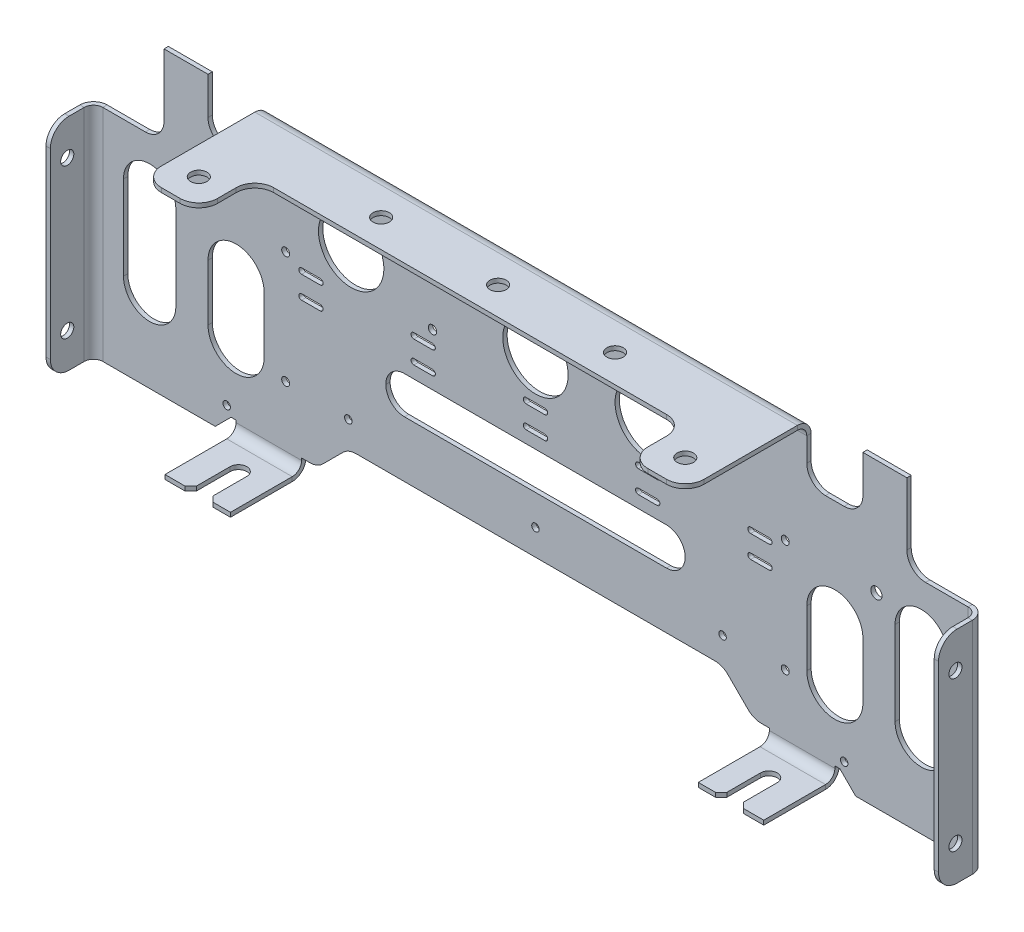
from build123d import *

# Parameters (mm, degrees)
SKETCH1_W                       = 477
SKETCH1_H                       = 127.62
BASE_FLANGE1_DEPTH              = 2.31
EDGE_FLANGE1_STRIP_W            = 19.24
EDGE_FLANGE1_STRIP_H            = 2.31
EDGE_FLANGE1_STRIP_CUT_DEPTH    = 127.62
EDGE_FLANGE1_STRIP_2_W          = 19.24
EDGE_FLANGE1_STRIP_2_H          = 2.31
EDGE_FLANGE1_STRIP_CUT_2_DEPTH  = 127.62
EDGE_FLANGE1_DEPTH              = 127.62
EDGE_FLANGE1_BEND_DEPTH         = 127.62
SKETCH12_W                      = 40
SKETCH12_H                      = 10
CUT_EXTRUDE1_DEPTH              = 249.191712392
SKETCH14_W                      = 397
SKETCH14_H                      = 33.43
BOSS_EXTRUDE1_DEPTH             = 2.31
FILLET1_R                       = 10
SKETCH15_R                      = 3.5
CUT_EXTRUDE3_DEPTH              = 488.357944123
CUT_EXTRUDE4_DEPTH              = 10
SKETCH17_W                      = 30
SKETCH17_H                      = 30
CUT_EXTRUDE5_DEPTH              = 10
SKETCH18_W                      = 160
SKETCH18_H                      = 20
CUT_EXTRUDE6_DEPTH              = 10
CUT_EXTRUDE8_REACH              = 260.811
SKETCH19_R                      = 2
SKETCH20_R                      = 17.4625
CUT_EXTRUDE9_DEPTH              = 10
FILLET2_R                       = 10
EDGE_FLANGE2_STRIP_W            = 19.24
EDGE_FLANGE2_STRIP_H            = 2.31
EDGE_FLANGE2_STRIP_CUT_DEPTH    = 290
EDGE_FLANGE2_DEPTH              = 290
SKETCH30_R                      = 2.25
CUT_EXTRUDE11_DEPTH             = 10
SKETCH32_W                      = 30
SKETCH32_H                      = 30
BOSS_EXTRUDE2_DEPTH             = 2.31
FILLET3_R                       = 10
SKETCH29_R                      = 4.375
CUT_EXTRUDE10_DEPTH             = 10
CUT_EXTRUDE12_DEPTH             = 10
EDGE_FLANGE3_STRIP_W            = 19.24
EDGE_FLANGE3_STRIP_H            = 2.31
EDGE_FLANGE3_STRIP_CUT_DEPTH    = 35
EDGE_FLANGE3_RELIEF_W           = 20.395
EDGE_FLANGE3_RELIEF_H           = 1.155
EDGE_FLANGE3_RELIEF_CUT_DEPTH   = 2.31
EDGE_FLANGE3_STRIP_2_W          = 19.24
EDGE_FLANGE3_STRIP_2_H          = 2.31
EDGE_FLANGE3_STRIP_CUT_2_DEPTH  = 35
EDGE_FLANGE3_RELIEF_2_W         = 20.395
EDGE_FLANGE3_RELIEF_2_H         = 1.155
EDGE_FLANGE3_RELIEF_CUT_2_DEPTH = 2.31
EDGE_FLANGE3_DEPTH              = 35
EDGE_FLANGE3_BEND_DEPTH         = 35
SKETCH40_W                      = 10
SKETCH40_H                      = 7.31
CUT_EXTRUDE13_DEPTH             = 10
FILLET4_R                       = 10
CHAMFER1_SIZE                   = 10
CUT_EXTRUDE14_DEPTH             = 10
CHAMFER2_SIZE                   = 3
SKETCH42_R                      = 2.125
SKETCH42_R_2                    = 3
CUT_EXTRUDE15_DEPTH             = 10


# Sheet-metal steps are written as plain solids
# Some blends are built 0.0001 mm under size
with BuildPart() as part:
    # Sketch1 → Base-Flange1 (new body)
    with BuildSketch(Plane.XY):
        Rectangle(SKETCH1_W, SKETCH1_H)
    extrude(amount=-BASE_FLANGE1_DEPTH)

    # Edge-Flange1 strip (across the edge) → Edge-Flange1 strip cut (cut)
    with BuildSketch(Plane(origin=(-238.5, 63.81, 0), x_dir=(1, 0, 0), z_dir=(0, -1, 0))):
        with Locations((-2.31, -1.155)):
            Rectangle(EDGE_FLANGE1_STRIP_W, EDGE_FLANGE1_STRIP_H)
    extrude(amount=EDGE_FLANGE1_STRIP_CUT_DEPTH, mode=Mode.SUBTRACT)

    # Edge-Flange1 strip 2 (across the edge) → Edge-Flange1 strip cut 2 (cut)
    with BuildSketch(Plane(origin=(238.5, -63.81, 0), x_dir=(-1, 0, 0), z_dir=(0, 1, 0))):
        with Locations((-2.31, -1.155)):
            Rectangle(EDGE_FLANGE1_STRIP_2_W, EDGE_FLANGE1_STRIP_2_H)
    extrude(amount=EDGE_FLANGE1_STRIP_CUT_2_DEPTH, mode=Mode.SUBTRACT)

    # Edge-Flange1 section (across the edge) → Edge-Flange1 (add)
    with BuildSketch(Plane(origin=(-238.5, 63.81, 0), x_dir=(1, 0, 0), z_dir=(0, -1, 0))):
        with BuildLine():
            Line((0, 5), (0, 23.09))
            Line((0, 23.09), (2.31, 23.09))
            Line((2.31, 23.09), (2.31, 5))
            ThreePointArc((2.31, 5), (3.774466094, 1.464466094), (7.31, 0))
            Line((7.31, 0), (7.31, -2.31))
            ThreePointArc((7.31, -2.31), (2.14104943, -0.16895057), (0, 5))
        make_face()
    extrude(amount=EDGE_FLANGE1_DEPTH)

    # Edge-Flange1 section 2 (across the edge) → Edge-Flange1 bend (add)
    with BuildSketch(Plane(origin=(238.5, -63.81, 0), x_dir=(-1, 0, 0), z_dir=(0, 1, 0))):
        with BuildLine():
            Line((0, 5), (0, 23.09))
            Line((0, 23.09), (2.31, 23.09))
            Line((2.31, 23.09), (2.31, 5))
            ThreePointArc((2.31, 5), (3.774466094, 1.464466094), (7.31, 0))
            Line((7.31, 0), (7.31, -2.31))
            ThreePointArc((7.31, -2.31), (2.14104943, -0.16895057), (0, 5))
        make_face()
    extrude(amount=EDGE_FLANGE1_BEND_DEPTH)

    # Sketch12 → Cut-Extrude1 (cut, through all)
    with BuildSketch(Plane.XY.offset(23.09)):
        with Locations((-218.5, 58.81)):
            Rectangle(SKETCH12_W, SKETCH12_H)
        with Locations((218.5, 58.81)):
            Rectangle(SKETCH12_W, SKETCH12_H)
    extrude(amount=-CUT_EXTRUDE1_DEPTH, mode=Mode.SUBTRACT)

    # Sketch14 → Boss-Extrude1 (add)
    with BuildSketch(Plane.XY):
        with Locations((0, 80.525)):
            Rectangle(SKETCH14_W, SKETCH14_H)
    extrude(amount=-BOSS_EXTRUDE1_DEPTH)

    # Fillet1
    fillet1_edges = [part.edges().sort_by_distance(p)[0] for p in [
        (237.345, 53.81, 23.09),
        (198.5, 53.81, -1.155),
        (-198.5, 53.81, -1.155),
        (-237.345, 53.81, 23.09),
    ]]
    fillet(fillet1_edges, radius=FILLET1_R)

    # Sketch15 → Cut-Extrude3 (cut, through all)
    with BuildSketch(Plane(origin=(238.5, 0, 0), x_dir=(0, 0, -1), z_dir=(1, 0, 0))):
        with Locations((-14.045, 35)):
            Circle(SKETCH15_R)
        with Locations((-14.045, -45)):
            Circle(SKETCH15_R)
    extrude(amount=-CUT_EXTRUDE3_DEPTH, mode=Mode.SUBTRACT)

    # Sketch16 → Cut-Extrude4 (cut)
    with BuildSketch(Plane.XY):
        Polygon((125, -63.81), (100, -38.81), (-100, -38.81), (-125, -63.81), align=None)
    extrude(amount=-CUT_EXTRUDE4_DEPTH, mode=Mode.SUBTRACT)

    # Sketch17 → Cut-Extrude5 (cut)
    with BuildSketch(Plane.XY):
        with BuildLine():
            Line((-145, 11.19), (-145, -18.81))
            ThreePointArc((-145, -18.81), (-160, -33.81), (-175, -18.81))
            Line((-175, -18.81), (-175, 11.19))
            ThreePointArc((-175, 11.19), (-160, 26.19), (-145, 11.19))
        make_face()
        with BuildLine():
            Line((145, 11.19), (145, -18.81))
            ThreePointArc((145, -18.81), (160, -33.81), (175, -18.81))
            Line((175, -18.81), (175, 11.19))
            ThreePointArc((175, 11.19), (160, 26.19), (145, 11.19))
        make_face()
        with BuildLine():
            Line((-192.19, 26.19), (-192.19, -18.81))
            ThreePointArc((-192.19, -18.81), (-206.19, -32.81), (-220.19, -18.81))
            Line((-220.19, -18.81), (-220.19, 26.19))
            ThreePointArc((-220.19, 26.19), (-206.19, 40.19), (-192.19, 26.19))
        make_face()
        with BuildLine():
            Line((192.19, 26.19), (192.19, -18.81))
            ThreePointArc((192.19, -18.81), (206.19, -32.81), (220.19, -18.81))
            Line((220.19, -18.81), (220.19, 26.19))
            ThreePointArc((220.19, 26.19), (206.19, 40.19), (192.19, 26.19))
        make_face()
        with Locations((160, 82.24)):
            Rectangle(SKETCH17_W, SKETCH17_H)
        with Locations((-160, 82.24)):
            Rectangle(SKETCH17_W, SKETCH17_H)
    extrude(amount=-CUT_EXTRUDE5_DEPTH, mode=Mode.SUBTRACT)

    # Sketch18 → Cut-Extrude6 (cut)
    with BuildSketch(Plane(origin=(0, 0, -2.31), x_dir=(-1, 0, 0), z_dir=(0, 0, -1))):
        with Locations((0, 1.19)):
            Rectangle(SKETCH18_W, SKETCH18_H)
    extrude(amount=-CUT_EXTRUDE6_DEPTH, mode=Mode.SUBTRACT)

    # Sketch19 → Cut-Extrude8 (cut, up to next)
    with BuildSketch(Plane(origin=(0, 0, -2.31), x_dir=(-1, 0, 0), z_dir=(0, 0, -1)), mode=Mode.PRIVATE) as cut_extrude8_sk1:
        with Locations((0, -25)):
            Circle(SKETCH19_R)
    cut_extrude8_tool1 = extrude(cut_extrude8_sk1.sketch, amount=-CUT_EXTRUDE8_REACH, mode=Mode.PRIVATE) & part.part
    # Sketch19 → Cut-Extrude8 (cut, up to next)
    with BuildSketch(Plane(origin=(0, 0, -2.31), x_dir=(-1, 0, 0), z_dir=(0, 0, -1)), mode=Mode.PRIVATE) as cut_extrude8_sk2:
        with Locations((100, -25)):
            Circle(SKETCH19_R)
    cut_extrude8_tool2 = extrude(cut_extrude8_sk2.sketch, amount=-CUT_EXTRUDE8_REACH, mode=Mode.PRIVATE) & part.part
    # Sketch19 → Cut-Extrude8 (cut, up to next)
    with BuildSketch(Plane(origin=(0, 0, -2.31), x_dir=(-1, 0, 0), z_dir=(0, 0, -1)), mode=Mode.PRIVATE) as cut_extrude8_sk3:
        with Locations((165, -50.955)):
            Circle(SKETCH19_R)
    cut_extrude8_tool3 = extrude(cut_extrude8_sk3.sketch, amount=-CUT_EXTRUDE8_REACH, mode=Mode.PRIVATE) & part.part
    # Sketch19 → Cut-Extrude8 (cut, up to next)
    with BuildSketch(Plane(origin=(0, 0, -2.31), x_dir=(-1, 0, 0), z_dir=(0, 0, -1)), mode=Mode.PRIVATE) as cut_extrude8_sk4:
        with Locations((-100, -25)):
            Circle(SKETCH19_R)
    cut_extrude8_tool4 = extrude(cut_extrude8_sk4.sketch, amount=-CUT_EXTRUDE8_REACH, mode=Mode.PRIVATE) & part.part
    # Sketch19 → Cut-Extrude8 (cut, up to next)
    with BuildSketch(Plane(origin=(0, 0, -2.31), x_dir=(-1, 0, 0), z_dir=(0, 0, -1)), mode=Mode.PRIVATE) as cut_extrude8_sk5:
        with Locations((-165, -50.955)):
            Circle(SKETCH19_R)
    cut_extrude8_tool5 = extrude(cut_extrude8_sk5.sketch, amount=-CUT_EXTRUDE8_REACH, mode=Mode.PRIVATE) & part.part
    add(cut_extrude8_tool1.solids().sort_by_distance((0, -25, -2.31))[0], mode=Mode.SUBTRACT)
    add(cut_extrude8_tool2.solids().sort_by_distance((-100, -25, -2.31))[0], mode=Mode.SUBTRACT)
    add(cut_extrude8_tool3.solids().sort_by_distance((-165, -50.955, -2.31))[0], mode=Mode.SUBTRACT)
    add(cut_extrude8_tool4.solids().sort_by_distance((100, -25, -2.31))[0], mode=Mode.SUBTRACT)
    add(cut_extrude8_tool5.solids().sort_by_distance((165, -50.955, -2.31))[0], mode=Mode.SUBTRACT)

    # Sketch20 → Cut-Extrude9 (cut)
    with BuildSketch(Plane(origin=(0, 0, -2.31), x_dir=(-1, 0, 0), z_dir=(0, 0, -1))):
        with Locations((0, 54.215)):
            Circle(SKETCH20_R)
        with Locations((98.5, 54.215)):
            Circle(SKETCH20_R)
        with Locations((-60, 54.215)):
            Circle(SKETCH20_R)
    extrude(amount=-CUT_EXTRUDE9_DEPTH, mode=Mode.SUBTRACT)

    # Fillet2
    fillet2_edges = [part.edges().sort_by_distance(p)[0] for p in [
        (-80, -8.81, -1.155),
        (80, -8.81, -1.155),
        (80, 11.19, -1.155),
        (-80, 11.19, -1.155),
        (-100, -38.81, -1.155),
        (100, -38.81, -1.155),
        (-175, 67.24, -1.155),
        (-145, 67.24, -1.155),
        (175, 67.24, -1.155),
        (145, 67.24, -1.155),
        (237.345, -63.81, 23.09),
        (-237.345, -63.81, 23.09),
    ]]
    fillet(fillet2_edges, radius=FILLET2_R - 0.0001)  # a hair under: the kernel refuses the full size

    # Edge-Flange2 strip (across the edge) → Edge-Flange2 strip cut (cut)
    with BuildSketch(Plane(origin=(145, 97.24, 0), x_dir=(0, -1, 0), z_dir=(-1, 0, 0))):
        with Locations((-2.31, -1.155)):
            Rectangle(EDGE_FLANGE2_STRIP_W, EDGE_FLANGE2_STRIP_H)
    extrude(amount=EDGE_FLANGE2_STRIP_CUT_DEPTH, mode=Mode.SUBTRACT)

    # Edge-Flange2 section (across the edge) → Edge-Flange2 (add)
    with BuildSketch(Plane(origin=(145, 97.24, 0), x_dir=(0, -1, 0), z_dir=(-1, 0, 0))):
        with BuildLine():
            Line((0, 5), (0, 34.925))
            Line((0, 34.925), (2.31, 34.925))
            Line((2.31, 34.925), (2.31, 5))
            ThreePointArc((2.31, 5), (3.774466094, 1.464466094), (7.31, 0))
            Line((7.31, 0), (7.31, -2.31))
            ThreePointArc((7.31, -2.31), (2.14104943, -0.16895057), (0, 5))
        make_face()
    extrude(amount=EDGE_FLANGE2_DEPTH)

    # Sketch30 → Cut-Extrude11 (cut)
    with BuildSketch(Plane(origin=(0, 0, -2.31), x_dir=(-1, 0, 0), z_dir=(0, 0, -1))):
        with Locations((55.008, 69.045)):
            Circle(SKETCH30_R)
        with Locations((55.008, 39.045)):
            Circle(SKETCH30_R)
    extrude(amount=-CUT_EXTRUDE11_DEPTH, mode=Mode.SUBTRACT)

    # Sketch32 → Boss-Extrude2 (add)
    with BuildSketch(Plane(origin=(0, 97.24, 0), x_dir=(1, 0, 0), z_dir=(0, 1, 0))):
        with Locations((-130, -49.925)):
            Rectangle(SKETCH32_W, SKETCH32_H)
        with Locations((130, -49.925)):
            Rectangle(SKETCH32_W, SKETCH32_H)
    extrude(amount=-BOSS_EXTRUDE2_DEPTH)

    # Fillet3
    fillet3_edges = [part.edges().sort_by_distance(p)[0] for p in [
        (115, 96.085, 34.925),
        (145, 96.085, 64.925),
        (115, 96.085, 64.925),
        (-115, 96.085, 34.925),
        (-145, 96.085, 64.925),
        (-115, 96.085, 64.925),
    ]]
    fillet(fillet3_edges, radius=FILLET3_R)

    # Sketch29 → Cut-Extrude10 (cut)
    with BuildSketch(Plane(origin=(0, 97.24, 0), x_dir=(1, 0, 0), z_dir=(0, 1, 0))):
        with Locations(Location((0, -19.9625, 0), (0, 0, 270))):
            Circle(SKETCH29_R)
        with Locations(Location((62.5, -19.9625, 0), (0, 0, 270))):
            Circle(SKETCH29_R)
        with Locations(Location((-130, -49.925, 0), (0, 0, 270))):
            Circle(SKETCH29_R)
        with Locations(Location((130, -49.925, 0), (0, 0, 270))):
            Circle(SKETCH29_R)
        with Locations(Location((-62.5, -19.9625, 0), (0, 0, 270))):
            Circle(SKETCH29_R)
    extrude(amount=-CUT_EXTRUDE10_DEPTH, mode=Mode.SUBTRACT)

    # Sketch33 → Cut-Extrude12 (cut)
    with BuildSketch(Plane(origin=(0, 0, -2.31), x_dir=(-1, 0, 0), z_dir=(0, 0, -1))):
        with BuildLine():
            Line((-115, 17.69), (-125, 17.69))
            ThreePointArc((-125, 17.69), (-126.5, 19.19), (-125, 20.69))
            Line((-125, 20.69), (-115, 20.69))
            ThreePointArc((-115, 20.69), (-113.5, 19.19), (-115, 17.69))
        make_face()
        with BuildLine():
            Line((-115, 29.69), (-125, 29.69))
            ThreePointArc((-125, 29.69), (-126.5, 31.19), (-125, 32.69))
            Line((-125, 32.69), (-115, 32.69))
            ThreePointArc((-115, 32.69), (-113.5, 31.19), (-115, 29.69))
        make_face()
        with BuildLine():
            Line((-55, 17.69), (-65, 17.69))
            ThreePointArc((-65, 17.69), (-66.5, 19.19), (-65, 20.69))
            Line((-65, 20.69), (-55, 20.69))
            ThreePointArc((-55, 20.69), (-53.5, 19.19), (-55, 17.69))
        make_face()
        with BuildLine():
            Line((-55, 29.69), (-65, 29.69))
            ThreePointArc((-65, 29.69), (-66.5, 31.19), (-65, 32.69))
            Line((-65, 32.69), (-55, 32.69))
            ThreePointArc((-55, 32.69), (-53.5, 31.19), (-55, 29.69))
        make_face()
        with BuildLine():
            Line((5, 17.69), (-5, 17.69))
            ThreePointArc((-5, 17.69), (-6.5, 19.19), (-5, 20.69))
            Line((-5, 20.69), (5, 20.69))
            ThreePointArc((5, 20.69), (6.5, 19.19), (5, 17.69))
        make_face()
        with BuildLine():
            Line((5, 29.69), (-5, 29.69))
            ThreePointArc((-5, 29.69), (-6.5, 31.19), (-5, 32.69))
            Line((-5, 32.69), (5, 32.69))
            ThreePointArc((5, 32.69), (6.5, 31.19), (5, 29.69))
        make_face()
        with BuildLine():
            Line((65, 17.69), (55, 17.69))
            ThreePointArc((55, 17.69), (53.5, 19.19), (55, 20.69))
            Line((55, 20.69), (65, 20.69))
            ThreePointArc((65, 20.69), (66.5, 19.19), (65, 17.69))
        make_face()
        with BuildLine():
            Line((65, 29.69), (55, 29.69))
            ThreePointArc((55, 29.69), (53.5, 31.19), (55, 32.69))
            Line((55, 32.69), (65, 32.69))
            ThreePointArc((65, 32.69), (66.5, 31.19), (65, 29.69))
        make_face()
        with BuildLine():
            Line((125, 17.69), (115, 17.69))
            ThreePointArc((115, 17.69), (113.5, 19.19), (115, 20.69))
            Line((115, 20.69), (125, 20.69))
            ThreePointArc((125, 20.69), (126.5, 19.19), (125, 17.69))
        make_face()
        with BuildLine():
            Line((125, 29.69), (115, 29.69))
            ThreePointArc((115, 29.69), (113.5, 31.19), (115, 32.69))
            Line((115, 32.69), (125, 32.69))
            ThreePointArc((125, 32.69), (126.5, 31.19), (125, 29.69))
        make_face()
    extrude(amount=-CUT_EXTRUDE12_DEPTH, mode=Mode.SUBTRACT)

    # Edge-Flange3 strip (across the edge) → Edge-Flange3 strip cut (cut)
    with BuildSketch(Plane(origin=(-160, -63.81, 0), x_dir=(0, 1, 0), z_dir=(1, 0, 0))):
        with Locations((-2.31, -1.155)):
            Rectangle(EDGE_FLANGE3_STRIP_W, EDGE_FLANGE3_STRIP_H)
    extrude(amount=EDGE_FLANGE3_STRIP_CUT_DEPTH, mode=Mode.SUBTRACT)

    # Edge-Flange3 relief (on the sheet) → Edge-Flange3 relief cut (cut)
    with BuildSketch(Plane(origin=(-160, -56.5, 0), x_dir=(0, 1, 0), z_dir=(0, 0, 1))):
        with Locations((-9.0425, 0.5775)):
            Rectangle(EDGE_FLANGE3_RELIEF_W, EDGE_FLANGE3_RELIEF_H)
        with Locations((-9.0425, -35.5775)):
            Rectangle(EDGE_FLANGE3_RELIEF_W, EDGE_FLANGE3_RELIEF_H)
    extrude(amount=-EDGE_FLANGE3_RELIEF_CUT_DEPTH, mode=Mode.SUBTRACT)

    # Edge-Flange3 strip 2 (across the edge) → Edge-Flange3 strip cut 2 (cut)
    with BuildSketch(Plane(origin=(125, -63.81, 0), x_dir=(0, 1, 0), z_dir=(1, 0, 0))):
        with Locations((-2.31, -1.155)):
            Rectangle(EDGE_FLANGE3_STRIP_2_W, EDGE_FLANGE3_STRIP_2_H)
    extrude(amount=EDGE_FLANGE3_STRIP_CUT_2_DEPTH, mode=Mode.SUBTRACT)

    # Edge-Flange3 relief 2 (on the sheet) → Edge-Flange3 relief cut 2 (cut)
    with BuildSketch(Plane(origin=(125, -56.5, 0), x_dir=(0, 1, 0), z_dir=(0, 0, 1))):
        with Locations((-9.0425, 0.5775)):
            Rectangle(EDGE_FLANGE3_RELIEF_2_W, EDGE_FLANGE3_RELIEF_2_H)
        with Locations((-9.0425, -35.5775)):
            Rectangle(EDGE_FLANGE3_RELIEF_2_W, EDGE_FLANGE3_RELIEF_2_H)
    extrude(amount=-EDGE_FLANGE3_RELIEF_CUT_2_DEPTH, mode=Mode.SUBTRACT)

    # Edge-Flange3 section (across the edge) → Edge-Flange3 (add)
    with BuildSketch(Plane(origin=(-160, -63.81, 0), x_dir=(0, 1, 0), z_dir=(1, 0, 0))):
        with BuildLine():
            Line((0, 5), (0, 38))
            Line((0, 38), (2.31, 38))
            Line((2.31, 38), (2.31, 5))
            ThreePointArc((2.31, 5), (3.774466094, 1.464466094), (7.31, 0))
            Line((7.31, 0), (7.31, -2.31))
            ThreePointArc((7.31, -2.31), (2.14104943, -0.16895057), (0, 5))
        make_face()
    extrude(amount=EDGE_FLANGE3_DEPTH)

    # Edge-Flange3 section 2 (across the edge) → Edge-Flange3 bend (add)
    with BuildSketch(Plane(origin=(125, -63.81, 0), x_dir=(0, 1, 0), z_dir=(1, 0, 0))):
        with BuildLine():
            Line((0, 5), (0, 38))
            Line((0, 38), (2.31, 38))
            Line((2.31, 38), (2.31, 5))
            ThreePointArc((2.31, 5), (3.774466094, 1.464466094), (7.31, 0))
            Line((7.31, 0), (7.31, -2.31))
            ThreePointArc((7.31, -2.31), (2.14104943, -0.16895057), (0, 5))
        make_face()
    extrude(amount=EDGE_FLANGE3_BEND_DEPTH)

    # Sketch40 → Cut-Extrude13 (cut)
    with BuildSketch(Plane.XY):
        with Locations((-118.845, -59)):
            Rectangle(SKETCH40_W, SKETCH40_H)
        with Locations((118.845, -59)):
            Rectangle(SKETCH40_W, SKETCH40_H)
    extrude(amount=-CUT_EXTRUDE13_DEPTH, mode=Mode.SUBTRACT)

    # Fillet4
    fillet4_edges = [part.edges().sort_by_distance(p)[0] for p in [
        (116.535, -55.345, -1.155),
        (-116.535, -55.345, -1.155),
    ]]
    fillet(fillet4_edges, radius=FILLET4_R)

    # Chamfer1
    # the kernel refuses this chamfer: 10 mm, written as the material it takes off along each edge
    with BuildSketch(Plane(origin=(-161.155, -63.81, 25.71682988), x_dir=(0.0274958766105877, 0.9996219169112968, 0), z_dir=(0, 0, -1))) as chamfer1_piece_1_section:
        Polygon((CHAMFER1_SIZE * 0.999621916911, -CHAMFER1_SIZE * 0.0274958766106), (-CHAMFER1_SIZE * 0.0274958766106, -CHAMFER1_SIZE * 0.999621916911), (0, 0), align=None)
    chamfer1_piece_1 = extrude(amount=53.743659759, mode=Mode.PRIVATE)
    chamfer1_piece_1 = split(chamfer1_piece_1, bisect_by=Plane(origin=(-164.561790425, -55.345, -1.155), z_dir=(0, -1, 0)), keep=Keep.TOP, mode=Mode.PRIVATE)
    add(chamfer1_piece_1, mode=Mode.SUBTRACT)
    with BuildSketch(Plane(origin=(161.155, -63.81, 25.71682988), x_dir=(-0.0274958766105877, 0.9996219169112968, 0), z_dir=(0, 0, -1))) as chamfer1_piece_2_section:
        Polygon((CHAMFER1_SIZE * 0.999621916911, CHAMFER1_SIZE * 0.0274958766106), (-CHAMFER1_SIZE * 0.0274958766106, CHAMFER1_SIZE * 0.999621916911), (0, 0), align=None)
    chamfer1_piece_2 = extrude(amount=53.743659759, mode=Mode.PRIVATE)
    chamfer1_piece_2 = split(chamfer1_piece_2, bisect_by=Plane(origin=(164.561790425, -55.345, -1.155), z_dir=(0, -1, 0)), keep=Keep.TOP, mode=Mode.PRIVATE)
    add(chamfer1_piece_2, mode=Mode.SUBTRACT)

    # Sketch41 → Cut-Extrude14 (cut)
    with BuildSketch(Plane(origin=(0, -61.5, 0), x_dir=(1, 0, 0), z_dir=(0, 1, 0))):
        with BuildLine():
            Line((146.243, -17), (146.243, -38))
            Line((146.243, -38), (137.243, -38))
            Line((137.243, -38), (137.243, -17))
            ThreePointArc((137.243, -17), (141.743, -12.5), (146.243, -17))
        make_face()
        with BuildLine():
            Line((-137.243, -38), (-137.243, -17))
            ThreePointArc((-137.243, -17), (-141.743, -12.5), (-146.243, -17))
            Line((-146.243, -17), (-146.243, -38))
            Line((-146.243, -38), (-137.243, -38))
        make_face()
    extrude(amount=-CUT_EXTRUDE14_DEPTH, mode=Mode.SUBTRACT)

    # Chamfer2
    chamfer2_edges = [part.edges().sort_by_distance(p)[0] for p in [
        (137.243, -62.655, 38),
        (146.243, -62.655, 38),
        (-146.243, -62.655, 38),
        (-137.243, -62.655, 38),
    ]]
    chamfer(chamfer2_edges, length=CHAMFER2_SIZE)

    # Sketch42 → Cut-Extrude15 (cut)
    with BuildSketch(Plane.XY):
        with Locations((-133.5, 35.81)):
            Circle(SKETCH42_R)
        with Locations((-133.5, -24.19)):
            Circle(SKETCH42_R)
        with Locations(Location((133.5, -24.19, 0), (0, 0, 180))):
            Circle(SKETCH42_R)
        with Locations(Location((133.5, 35.81, 0), (0, 0, 180))):
            Circle(SKETCH42_R)
        with Locations((-182.19, 35.81)):
            Circle(SKETCH42_R_2)
        with Locations(Location((182.19, 35.81, 0), (0, 0, 180))):
            Circle(SKETCH42_R_2)
    extrude(amount=-CUT_EXTRUDE15_DEPTH, mode=Mode.SUBTRACT)


solid = part.part
